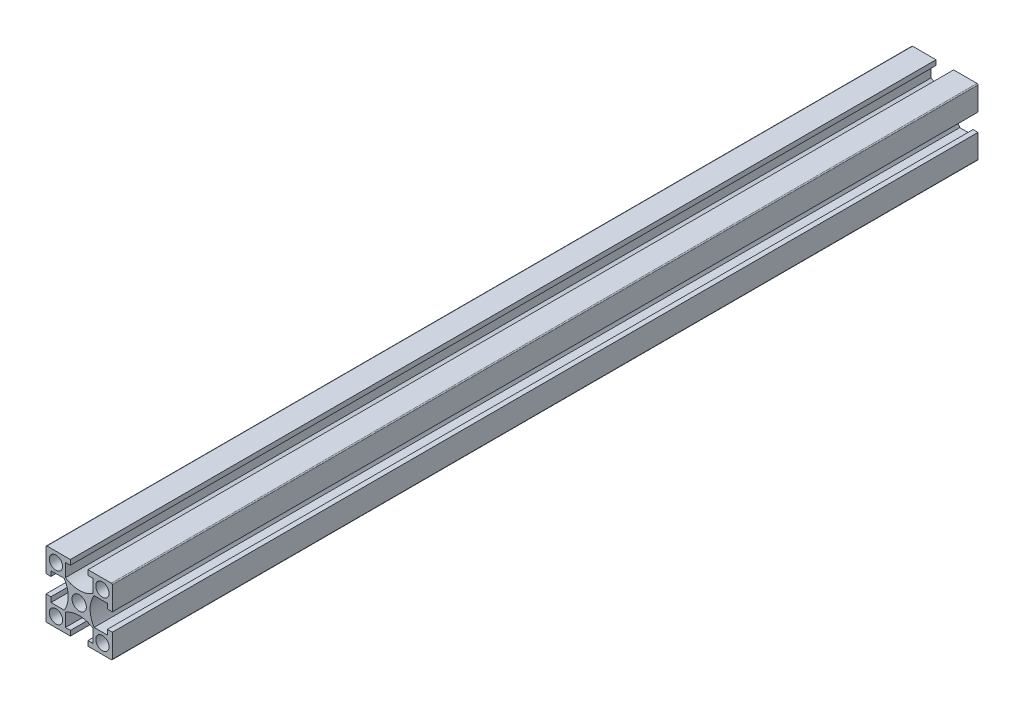
from build123d import *

# Parameters (mm, degrees)
SKETCH_1_W               = 20
SKETCH_1_H               = 20
SKETCH_1_R               = 2
SKETCH_1_R_2             = 2.15
EXTRUDE_1_DEPTH          = 261
CUT_EXTRUDE_1_REACH      = 263.383
PATTERN_CIRCULAR_1_COUNT = 4
FILLET_1_R               = 0.3
SKETCH_3_R               = 2.5
CUT_EXTRUDE_2_DEPTH      = 262.956103193
SKETCH_4_R               = 2.15
CUT_EXTRUDE_3_DEPTH      = 262.956103293


with BuildPart() as part:
    # 스케치1 → 보스-돌출1 (new body)
    with BuildSketch(Plane.XY):
        Rectangle(SKETCH_1_W, SKETCH_1_H)
        with Locations((-7, -7)):
            Circle(SKETCH_1_R, mode=Mode.SUBTRACT)
        with Locations((7, -7)):
            Circle(SKETCH_1_R, mode=Mode.SUBTRACT)
        with Locations((-7, 7)):
            Circle(SKETCH_1_R, mode=Mode.SUBTRACT)
        Circle(SKETCH_1_R_2, mode=Mode.SUBTRACT)
        with Locations((7, 7)):
            Circle(SKETCH_1_R, mode=Mode.SUBTRACT)
    extrude(amount=EXTRUDE_1_DEPTH)

    # 스케치1<3> → 컷-돌출1 (cut, up to next)
    with BuildSketch(Plane.XY, mode=Mode.PRIVATE) as cut_extrude_1_sk1:
        with BuildLine():
            Line((-8.5, 2.65), (-10, 2.65))
            Line((-10, 2.65), (-10, -2.65))
            Line((-10, -2.65), (-8.5, -2.65))
            Line((-8.5, -2.65), (-8.5, -4.15))
            Line((-8.5, -4.15), (-4.503166667, -4.15))
            ThreePointArc((-4.503166667, -4.15), (-3.3, 0), (-4.503166667, 4.15))
            Line((-4.503166667, 4.15), (-8.5, 4.15))
            Line((-8.5, 4.15), (-8.5, 2.65))
        make_face()
    cut_extrude_1_tool1 = extrude(cut_extrude_1_sk1.sketch, amount=CUT_EXTRUDE_1_REACH, mode=Mode.PRIVATE) & part.part
    cut_extrude_1 = cut_extrude_1_tool1.solids().sort_by_distance((-6.606913, 0, 0))[0]
    add(cut_extrude_1, mode=Mode.SUBTRACT)

    # 원형 패턴1: 컷-돌출1 ×4 about axis
    pattern_circular_1_axis = Axis((0, 0, 261), (0, 0, -1))
    for i in range(1, PATTERN_CIRCULAR_1_COUNT):
        add(cut_extrude_1.rotate(pattern_circular_1_axis, i * 360 / PATTERN_CIRCULAR_1_COUNT), mode=Mode.SUBTRACT)

    # 필렛1
    fillet_1_edges = [part.edges().sort_by_distance(p)[0] for p in [
        (10, -10, 130.5),
        (-10, -10, 130.5),
        (-10, 10, 130.5),
        (10, 10, 130.5),
    ]]
    fillet(fillet_1_edges, radius=FILLET_1_R)

    # 스케치3 → 컷-돌출2 (cut, through all)
    with BuildSketch(Plane(origin=(0, 10, 0), x_dir=(1, 0, 0), z_dir=(0, 1, 0))):
        with Locations((0, -11)):
            Circle(SKETCH_3_R)
        with Locations((0, -250)):
            Circle(SKETCH_3_R)
    extrude(amount=-CUT_EXTRUDE_2_DEPTH, mode=Mode.SUBTRACT)

    # 스케치4 → 컷-돌출3 (cut, through all)
    with BuildSketch(Plane(origin=(0, 10, 0), x_dir=(1, 0, 0), z_dir=(0, 1, 0))):
        with Locations((0, -108)):
            Circle(SKETCH_4_R)
        with Locations((0, -56)):
            Circle(SKETCH_4_R)
    extrude(amount=-CUT_EXTRUDE_3_DEPTH, mode=Mode.SUBTRACT)


solid = part.part
